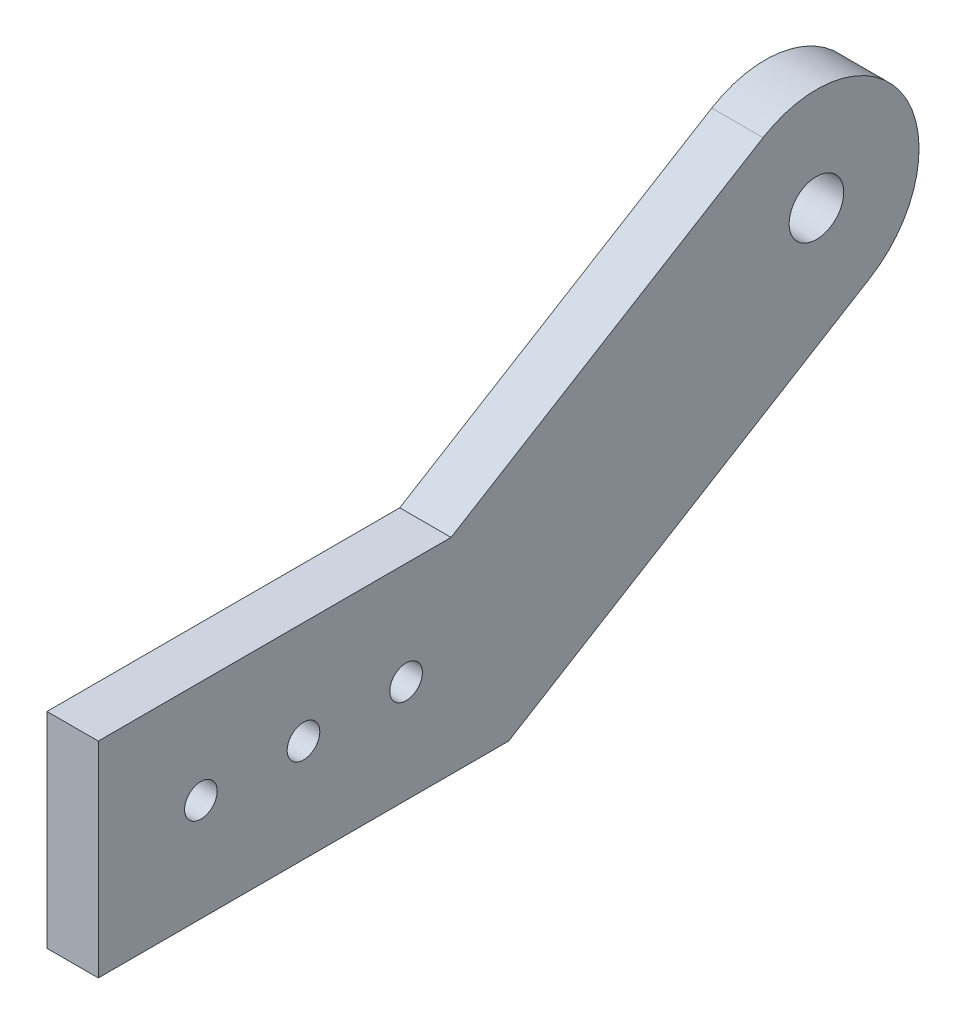
from build123d import *

# Parameters (mm, degrees)
BOSS_EXTRUDE1_DEPTH     = 6.35
F_10_32_TAPPED_HOLE1_D  = 4.0386
F_1_4_CLEARANCE_HOLE1_D = 6.7564


with BuildPart() as part:
    # Sketch1 → Boss-Extrude1 (new body)
    with BuildSketch(Plane(origin=(0, 0, 0), x_dir=(0, 0, -1), z_dir=(1, 0, 0))):
        with BuildLine():
            Line((50.8, 0), (95.510573574, 27.256093092))
            ThreePointArc((95.510573574, 27.256093092), (99.743906908, 44.710573574), (82.289426426, 48.943906908))
            Line((82.289426426, 48.943906908), (43.668279277, 25.4))
            Line((43.668279277, 25.4), (0, 25.4))
            Line((0, 25.4), (0, 0))
            Line((0, 0), (50.8, 0))
        make_face()
    extrude(amount=BOSS_EXTRUDE1_DEPTH)

    # #10-32 Tapped Hole1 (through all)
    with Locations(Plane(origin=(6.35, 0, 0), x_dir=(0, 0, -1), z_dir=(1, 0, 0))):
        with Locations((12.7, 12.7), (25.4, 12.7), (38.1, 12.7)):
            Hole(F_10_32_TAPPED_HOLE1_D / 2)

    # 1/4 Clearance Hole1 (through all)
    with Locations(Plane(origin=(6.35, 0, 0), x_dir=(0, 0, -1), z_dir=(1, 0, 0))):
        with Locations((88.9, 38.1)):
            Hole(F_1_4_CLEARANCE_HOLE1_D / 2)


solid = part.part
